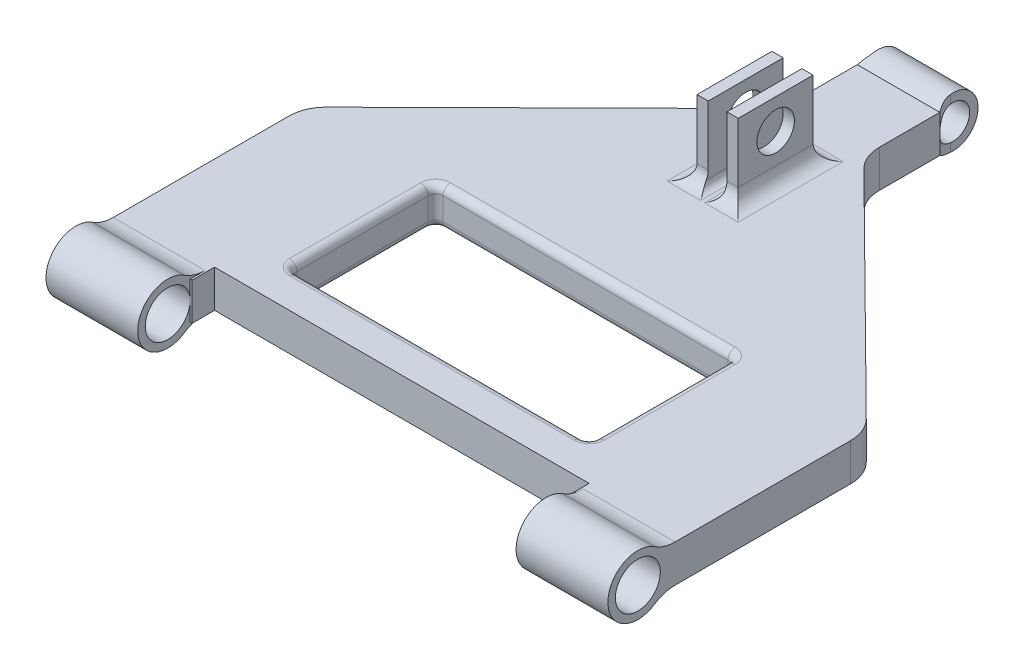
from build123d import *

# Parameters (mm, degrees)
SKETCH1_W                = 80
SKETCH1_H                = 39
BOSS_EXTRUDE1_DEPTH      = 10
BOSS_EXTRUDE2_START      = -12.5
SKETCH4_R                = 8
SKETCH4_R_2              = 6
BOSS_EXTRUDE2_DEPTH      = 24.5
SKETCH10_W               = 22.023984498
SKETCH10_H               = 20.291265962
BOSS_EXTRUDE4_DEPTH      = 10
SKETCH13_W               = 3
SKETCH13_H               = 20
BOSS_EXTRUDE5_DEPTH      = 20
SKETCH14_R               = 5
CUT_EXTRUDE1_DEPTH       = 15
BOSS_EXTRUDE6_DEPTH      = 10
BOSS_EXTRUDE6_DEPTH_BACK = 10
SKETCH16_R               = 6.726812024
SKETCH16_R_2             = 4.5
FILLET2_R                = 4
FILLET4_R                = 2
FILLET8_R                = 10
FILLET9_R                = 8
FILLET15_R               = 4
FILLET16_R               = 2


with BuildPart() as part:
    # Sketch1 → Boss-Extrude1 (new body)
    with BuildSketch(Plane(origin=(0, 0, 0), x_dir=(1, 0, 0), z_dir=(0, 1, 0))):
        Polygon((11.011992249, 112.28929502), (75, 49), (75, -6), (50, -6), (50, 0), (-50, 0), (-50, -6), (-75, -6), (-75, 49), (-11.011992249, 112.28929502), align=None)
        with Locations((0, 29.5)):
            Rectangle(SKETCH1_W, SKETCH1_H, mode=Mode.SUBTRACT)
    extrude(amount=BOSS_EXTRUDE1_DEPTH)

    # Sketch4 → Boss-Extrude2 (add)
    with BuildSketch(Plane(origin=(-62.5, 0, 0), x_dir=(0, 0, -1), z_dir=(1, 0, 0)).offset(BOSS_EXTRUDE2_START)):
        with Locations((-12, 5)):
            Circle(SKETCH4_R)
        with Locations((-12, 5)):
            Circle(SKETCH4_R_2, mode=Mode.SUBTRACT)
    boss_extrude2 = extrude(amount=BOSS_EXTRUDE2_DEPTH)

    # Mirror1: Boss-Extrude2 across plane
    add(boss_extrude2.mirror(Plane(origin=(0, 0, 0), x_dir=(0, 0, 1), z_dir=(1, 0, 0))))

    # Sketch10 → Boss-Extrude4 (add)
    with BuildSketch(Plane(origin=(0, 10, 0), x_dir=(1, 0, 0), z_dir=(0, 1, 0))):
        with Locations((0, 122.434928001)):
            Rectangle(SKETCH10_W, SKETCH10_H)
    extrude(amount=-BOSS_EXTRUDE4_DEPTH)

    # Sketch13 → Boss-Extrude5 (add)
    with BuildSketch(Plane(origin=(0, 10, 0), x_dir=(1, 0, 0), z_dir=(0, 1, 0))):
        with Locations((-4, 94.28929502)):
            Rectangle(SKETCH13_W, SKETCH13_H)
        with Locations((4, 94.28929502)):
            Rectangle(SKETCH13_W, SKETCH13_H)
    extrude(amount=BOSS_EXTRUDE5_DEPTH)

    # Sketch14 → Cut-Extrude1 (cut)
    with BuildSketch(Plane(origin=(5.5, 0, 0), x_dir=(0, 0, -1), z_dir=(1, 0, 0))):
        with Locations((94.28929502, 22)):
            Circle(SKETCH14_R)
    extrude(amount=-CUT_EXTRUDE1_DEPTH, mode=Mode.SUBTRACT)

    # Sketch16 → Boss-Extrude6 (add, two sides: drawn at the far end of the back side and taken through both)
    with BuildSketch(Plane(origin=(0, 0, 0), x_dir=(0, 0, -1), z_dir=(1, 0, 0)).offset(-BOSS_EXTRUDE6_DEPTH_BACK)):
        with Locations((137.080560982, 5)):
            Circle(SKETCH16_R)
        with Locations(Location((137.080560982, 5, 0), (0, 0, 180))):
            Circle(SKETCH16_R_2, mode=Mode.SUBTRACT)
    extrude(amount=BOSS_EXTRUDE6_DEPTH + BOSS_EXTRUDE6_DEPTH_BACK)

    # Fillet2
    fillet2_edges = [part.edges().sort_by_distance(p)[0] for p in [
        (-4, 10, -104.28929502),
        (-5.5, 10, -94.28929502),
        (-4, 10, -84.28929502),
    ]]
    fillet(fillet2_edges, radius=FILLET2_R)

    # Fillet4
    fillet4_edges = [part.edges().sort_by_distance(p)[0] for p in [
        (40, 0, -29.5),
        (0, 0, -49),
        (-40, 0, -29.5),
        (0, 0, -10),
        (40, 5, -10),
        (40, 5, -49),
        (-40, 5, -49),
        (-40, 5, -10),
        (0, 10, -10),
        (-40, 10, -29.5),
        (0, 10, -49),
        (40, 10, -29.5),
    ]]
    fillet(fillet4_edges, radius=FILLET4_R)

    # Fillet8
    fillet8_edges = [part.edges().sort_by_distance(p)[0] for p in [
        (11.011992249, 5, -112.28929502),
        (75, 5, -49),
        (-75, 5, -49),
        (-11.011992249, 5, -112.28929502),
        (-62.75, 0, 5.755002002),
        (-62.75, 10, 5.755002002),
        (62.75, 0, 5.755002002),
        (62.75, 10, 5.755002002),
    ]]
    fillet(fillet8_edges, radius=FILLET8_R)

    # Fillet9
    # the kernel refuses this fillet: 8 mm, written as the material it adds along each edge
    with BuildSketch(Plane(origin=(10, 5, -132.580560982), x_dir=(1, 0, 0), z_dir=(0, -1, 0))) as fillet9_piece_1_section:
        with BuildLine():
            CenterArc((8, -3.894579268), FILLET9_R, 150.868059199, 29.131940801)
            Line((0, -3.894579268), (0, 0))
            Line((0, 0), (1.011992249, 0))
        make_face()
    fillet9_piece_1 = extrude(amount=14.73644817, mode=Mode.PRIVATE)
    fillet9_piece_1 = fillet9_piece_1 - Plane(origin=(10, 5, -137.080560982), x_dir=(0, 0, 1), z_dir=(-1, 0, 0)) * Cylinder(4.5, 46, mode=Mode.PRIVATE)
    fillet9_piece_1 = fillet9_piece_1 & Plane(origin=(10, 5, -137.080560982), x_dir=(0, 0, -1), z_dir=(-1, 0, 0)) * Cylinder(6.726812024, 46, mode=Mode.PRIVATE)
    add(fillet9_piece_1)
    with BuildSketch(Plane(origin=(10, 19.73644817, -132.580560982), x_dir=(1, 0, 0), z_dir=(0, -1, 0))) as fillet9_piece_2_section:
        with BuildLine():
            CenterArc((8, -3.894579268), FILLET9_R, 150.868059199, 29.131940801)
            Line((0, -3.894579268), (0, 0))
            Line((0, 0), (1.011992249, 0))
        make_face()
    fillet9_piece_2 = extrude(amount=14.73644817, mode=Mode.PRIVATE)
    fillet9_piece_2 = fillet9_piece_2 - Plane(origin=(10, 5, -137.080560982), x_dir=(0, 0, 1), z_dir=(-1, 0, 0)) * Cylinder(4.5, 46, mode=Mode.PRIVATE)
    fillet9_piece_2 = fillet9_piece_2 & Plane(origin=(10, 5, -137.080560982), x_dir=(0, 0, -1), z_dir=(-1, 0, 0)) * Cylinder(6.726812024, 46, mode=Mode.PRIVATE)
    add(fillet9_piece_2)
    with BuildSketch(Plane(origin=(-10, 5, -132.580560982), x_dir=(0, 0, -1), z_dir=(0, -1, 0))) as fillet9_piece_3_section:
        with BuildLine():
            CenterArc((3.894579268, -8), FILLET9_R, 90, 29.131940801)
            Line((0, -1.011992249), (0, 0))
            Line((0, 0), (3.894579268, 0))
        make_face()
    fillet9_piece_3 = extrude(amount=14.73644817, mode=Mode.PRIVATE)
    fillet9_piece_3 = fillet9_piece_3 - Plane(origin=(-10, 5, -137.080560982), x_dir=(0, 0, 1), z_dir=(-1, 0, 0)) * Cylinder(4.5, 46, mode=Mode.PRIVATE)
    fillet9_piece_3 = fillet9_piece_3 & Plane(origin=(-10, 5, -137.080560982), x_dir=(0, 0, -1), z_dir=(-1, 0, 0)) * Cylinder(6.726812024, 46, mode=Mode.PRIVATE)
    add(fillet9_piece_3)
    with BuildSketch(Plane(origin=(-10, 19.73644817, -132.580560982), x_dir=(0, 0, -1), z_dir=(0, -1, 0))) as fillet9_piece_4_section:
        with BuildLine():
            CenterArc((3.894579268, -8), FILLET9_R, 90, 29.131940801)
            Line((0, -1.011992249), (0, 0))
            Line((0, 0), (3.894579268, 0))
        make_face()
    fillet9_piece_4 = extrude(amount=14.73644817, mode=Mode.PRIVATE)
    fillet9_piece_4 = fillet9_piece_4 - Plane(origin=(-10, 5, -137.080560982), x_dir=(0, 0, 1), z_dir=(-1, 0, 0)) * Cylinder(4.5, 46, mode=Mode.PRIVATE)
    fillet9_piece_4 = fillet9_piece_4 & Plane(origin=(-10, 5, -137.080560982), x_dir=(0, 0, -1), z_dir=(-1, 0, 0)) * Cylinder(6.726812024, 46, mode=Mode.PRIVATE)
    add(fillet9_piece_4)

    # Fillet15
    fillet15_edges = [part.edges().sort_by_distance(p)[0] for p in [
        (5.5, 10, -94.28929502),
        (4, 10, -104.28929502),
        (4, 10, -84.28929502),
    ]]
    fillet(fillet15_edges, radius=FILLET15_R)

    # Fillet16
    fillet16_edges = [part.edges().sort_by_distance(p)[0] for p in [
        (2.5, 10, -94.28929502),
        (-2.5, 10, -94.28929502),
    ]]
    fillet(fillet16_edges, radius=FILLET16_R)


solid = part.part
